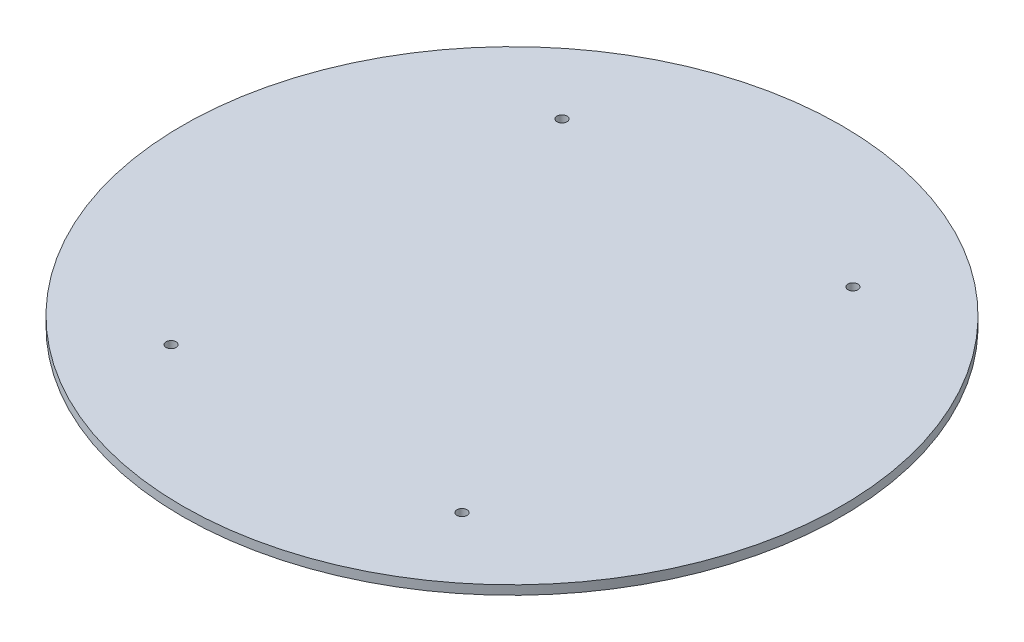
from build123d import *

# Parameters (mm, degrees)
SKETCH_2_R               = 72.5
EXTRUDE_1_DEPTH          = 2
CUT_EXTRUDE_1_DEPTH      = 103.549987811
CUT_EXTRUDE_1_DEPTH_BACK = 103.549987811
SKETCH_3_R               = 1.1


with BuildPart() as part:
    # 草图2 → 凸台-拉伸1 (new body)
    with BuildSketch(Plane(origin=(0, 0, 0), x_dir=(1, 0, 0), z_dir=(0, 1, 0))):
        Circle(SKETCH_2_R)
    extrude(amount=EXTRUDE_1_DEPTH)

    # 草图3 → 切除-拉伸1 (cut, two sides: drawn at the far end of the back side and taken through both)
    with BuildSketch(Plane.XZ.offset(-CUT_EXTRUDE_1_DEPTH_BACK)):
        with Locations((32, 43)):
            Circle(SKETCH_3_R)
        with Locations((-32, 43)):
            Circle(SKETCH_3_R)
        with Locations((-32, -43)):
            Circle(SKETCH_3_R)
        with Locations((32, -43)):
            Circle(SKETCH_3_R)
    extrude(amount=CUT_EXTRUDE_1_DEPTH + CUT_EXTRUDE_1_DEPTH_BACK, mode=Mode.SUBTRACT)


solid = part.part
